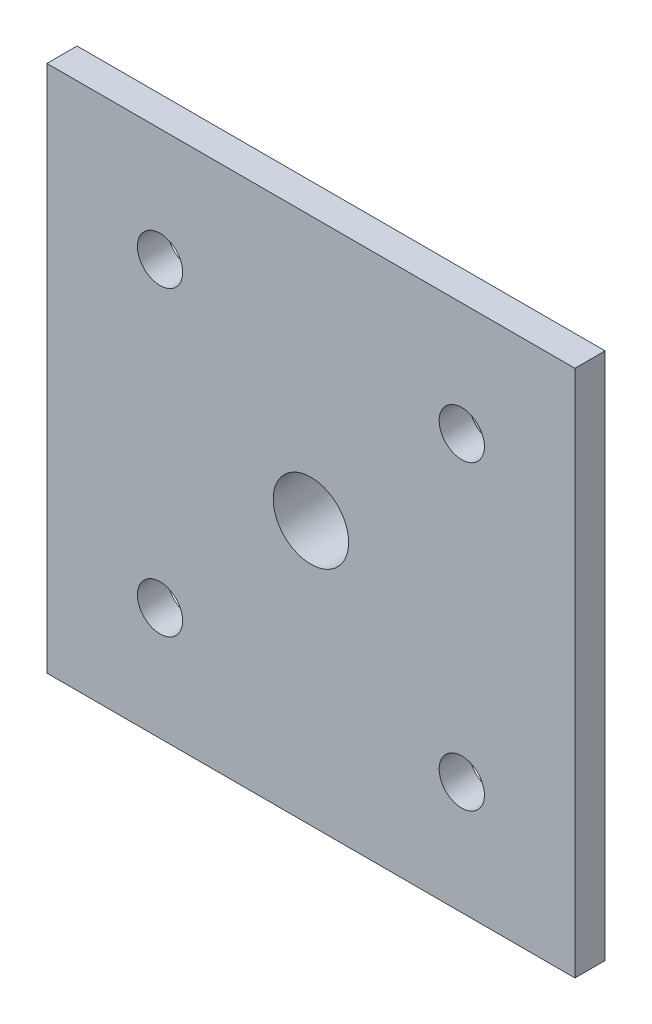
from build123d import *
from build123d.topology import SkipClean

# Parameters (mm, degrees)
SKETCH1_W           = 35
SKETCH1_H           = 35
BOSS_EXTRUDE1_DEPTH = 2
SKETCH2_R           = 2.5
SKETCH2_R_2         = 1.5
CUT_EXTRUDE1_DEPTH  = 3
SKETCH3_R           = 7.5
SKETCH3_R_2         = 2.5
BOSS_EXTRUDE2_DEPTH = 5


with BuildPart() as part:
    # Sketch1 → Boss-Extrude1 (new body)
    with BuildSketch(Plane.XY):
        Rectangle(SKETCH1_W, SKETCH1_H)
    extrude(amount=BOSS_EXTRUDE1_DEPTH)

    # Sketch2 → Cut-Extrude1 (cut)
    with BuildSketch(Plane.XY.offset(2)):
        Circle(SKETCH2_R)
        with Locations((-10, 10)):
            Circle(SKETCH2_R_2)
        with Locations((10, 10)):
            Circle(SKETCH2_R_2)
        with Locations((10, -10)):
            Circle(SKETCH2_R_2)
        with Locations((-10, -10)):
            Circle(SKETCH2_R_2)
    extrude(amount=-CUT_EXTRUDE1_DEPTH, mode=Mode.SUBTRACT)

    # Sketch3 → Boss-Extrude2 (add)
    with SkipClean():  # the faces are left unmerged after this step: merging them gives an invalid solid
        with BuildSketch(Plane(origin=(0, 0, 0), x_dir=(-1, 0, 0), z_dir=(0, 0, -1))):
            Circle(SKETCH3_R)
            Circle(SKETCH3_R_2, mode=Mode.SUBTRACT)
        extrude(amount=BOSS_EXTRUDE2_DEPTH)


solid = part.part
